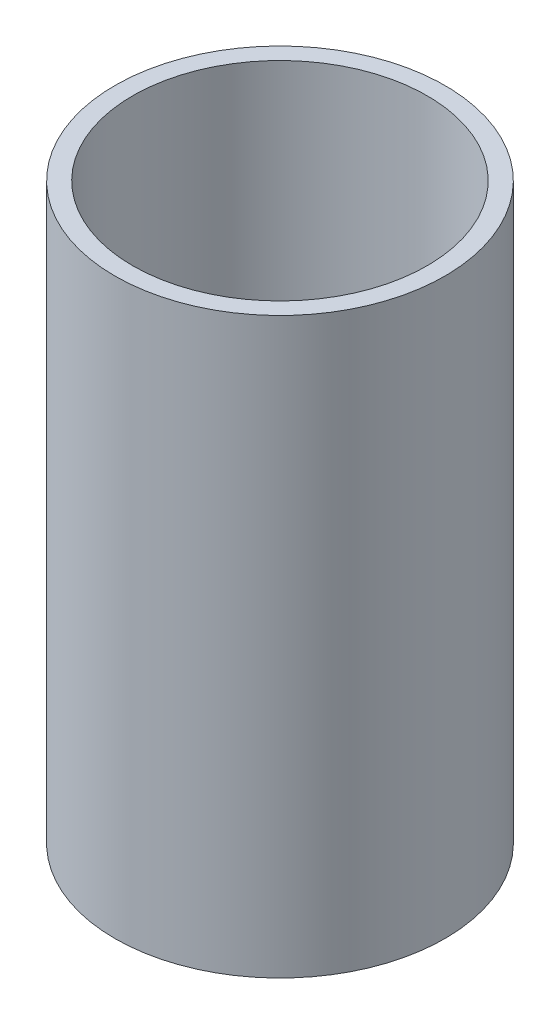
from build123d import *

# Parameters (mm, degrees)
SKETCH1_R           = 42.5
BOSS_EXTRUDE1_DEPTH = 147.763626696
SKETCH2_R           = 37.923173644
CUT_EXTRUDE1_DEPTH  = 160.519871409


with BuildPart() as part:
    # Sketch1 → Boss-Extrude1 (new body)
    with BuildSketch(Plane(origin=(0, 0, 0), x_dir=(1, 0, 0), z_dir=(0, 1, 0))):
        Circle(SKETCH1_R)
    extrude(amount=BOSS_EXTRUDE1_DEPTH)

    # Sketch2 → Cut-Extrude1 (cut, through all)
    with BuildSketch(Plane(origin=(0, 0, 0), x_dir=(1, 0, 0), z_dir=(0, 1, 0))):
        Circle(SKETCH2_R)
    extrude(amount=CUT_EXTRUDE1_DEPTH, mode=Mode.SUBTRACT)


solid = part.part
